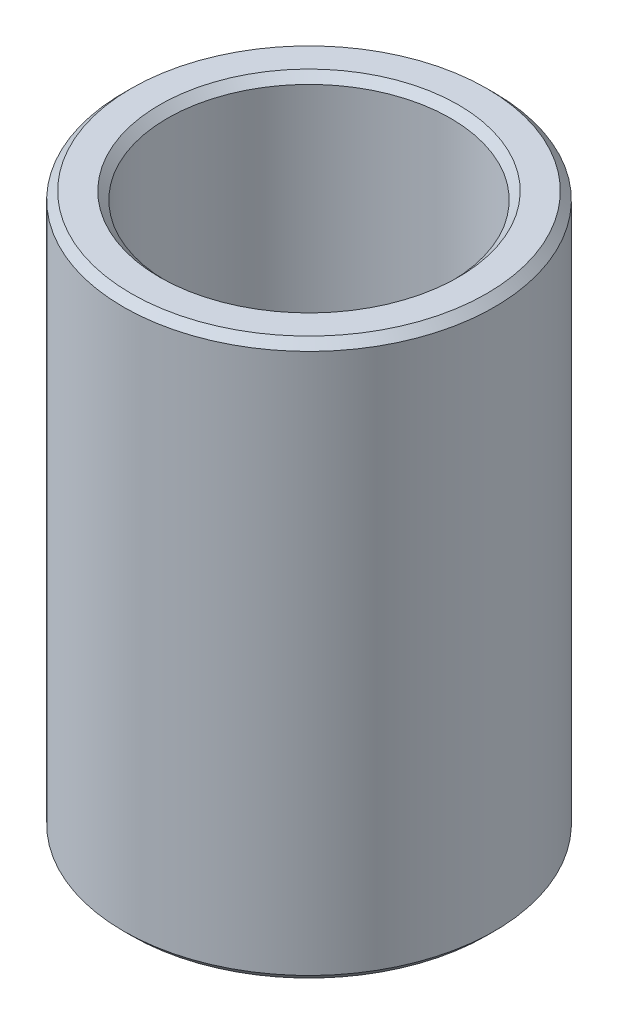
from build123d import *

# Parameters (mm, degrees)
SKETCH1_R           = 40
BOSS_EXTRUDE1_DEPTH = 119.880863888
SKETCH2_R           = 30.529090184
CUT_EXTRUDE1_DEPTH  = 133.55723868
CHAMFER1_SIZE       = 1.676082849


with BuildPart() as part:
    # Sketch1 → Boss-Extrude1 (new body)
    with BuildSketch(Plane(origin=(0, 0, 0), x_dir=(1, 0, 0), z_dir=(0, 1, 0))):
        Circle(SKETCH1_R)
    extrude(amount=BOSS_EXTRUDE1_DEPTH)

    # Sketch2 → Cut-Extrude1 (cut, through all)
    with BuildSketch(Plane(origin=(0, 0, 0), x_dir=(1, 0, 0), z_dir=(0, 1, 0))):
        Circle(SKETCH2_R)
    extrude(amount=CUT_EXTRUDE1_DEPTH, mode=Mode.SUBTRACT)

    # Chamfer1
    chamfer1_edges = [part.edges().sort_by_distance(p)[0] for p in [
        (-30.529090184, 119.880863888, 0),
        (-30.529090184, 0, 0),
        (-40, 0, 0),
        (-40, 119.880863888, 0),
    ]]
    chamfer(chamfer1_edges, length=CHAMFER1_SIZE)


solid = part.part
